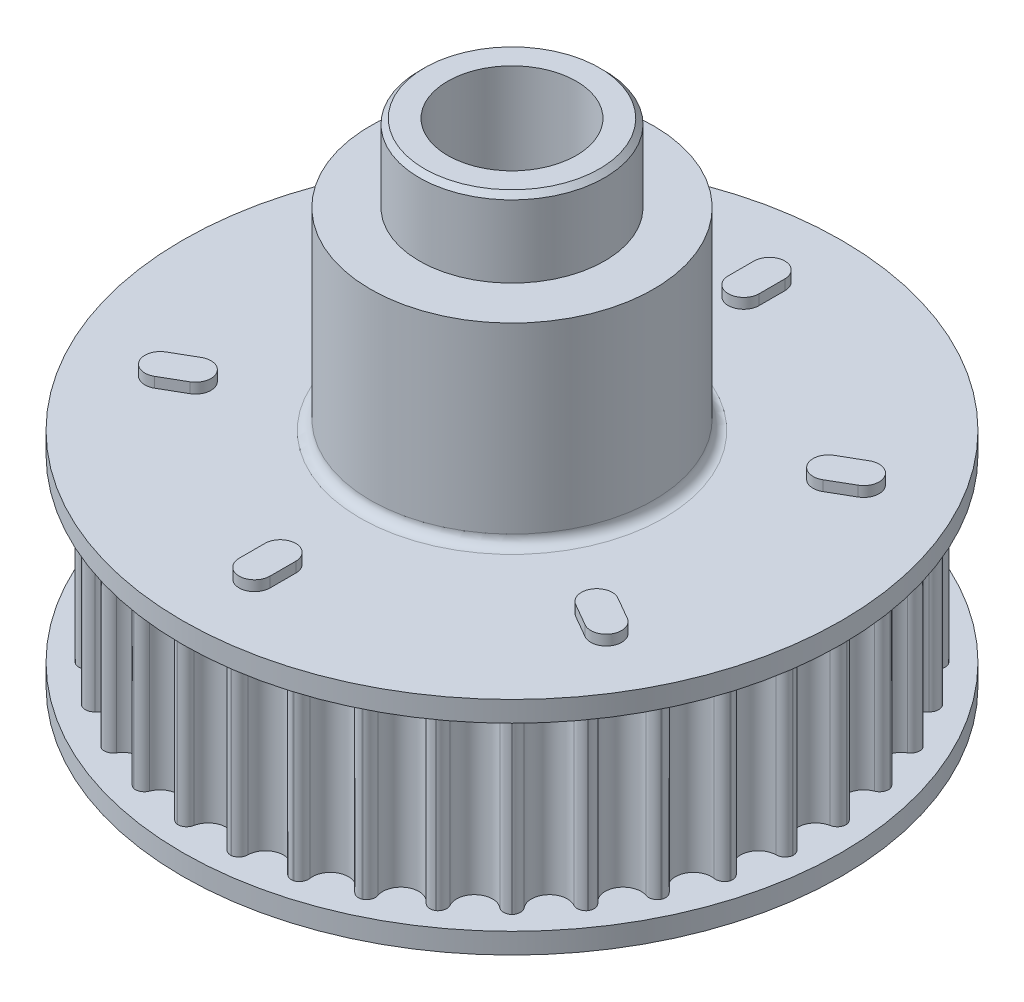
from build123d import *

# Parameters (mm, degrees)
SKETCH1_R           = 12
SKETCH1_R_2         = 2.5
BOSS_EXTRUDE1_DEPTH = 7
CUT_EXTRUDE1_DEPTH  = 19.357559751
CIRPATTERN1_COUNT   = 36
SKETCH4_R           = 12.8
SKETCH4_R_2         = 3.15
BOSS_EXTRUDE4_DEPTH = 0.8
SKETCH5_R           = 12.8
SKETCH5_R_2         = 2.5
BOSS_EXTRUDE5_DEPTH = 0.8
SKETCH6_R           = 5.5
SKETCH6_R_2         = 2.5
BOSS_EXTRUDE6_DEPTH = 7.5
FILLET4_R           = 0.4
SKETCH14_R          = 4.1
CUT_EXTRUDE5_DEPTH  = 3
SKETCH16_R          = 3.6
SKETCH16_R_2        = 2.5
BOSS_EXTRUDE7_DEPTH = 3
SKETCH17_R          = 3.6
CUT_EXTRUDE6_DEPTH  = 1
CHAMFER1_SIZE       = 0.2
BOSS_EXTRUDE8_DEPTH = 0.4
CHAMFER2_SIZE       = 1


with BuildPart() as part:
    # Sketch1 → Boss-Extrude1 (new body)
    with BuildSketch(Plane(origin=(0, 0, 0), x_dir=(1, 0, 0), z_dir=(0, 1, 0))):
        with Locations(Location((0, 0, 0), (0, 0, 270))):
            Circle(SKETCH1_R)
        with Locations(Location((0, 0, 0), (0, 0, 270))):
            Circle(SKETCH1_R_2, mode=Mode.SUBTRACT)
    extrude(amount=BOSS_EXTRUDE1_DEPTH)

    # Sketch2 → Cut-Extrude1 (cut, through all)
    with BuildSketch(Plane(origin=(0, 7, 0), x_dir=(1, 0, 0), z_dir=(0, 1, 0))):
        with BuildLine():
            Line((-1.031733977, 11.955), (-1.2, 11.955))
            Line((-1.2, 11.955), (-1.2, 12.151537955))
            Line((-1.2, 12.151537955), (1.2, 12.151537955))
            Line((1.2, 12.151537955), (1.2, 11.955))
            Line((1.2, 11.955), (1.031733977, 11.955))
            ThreePointArc((1.031733977, 11.955), (0.808406863, 11.87449026), (0.687822652, 11.67))
            ThreePointArc((0.687822652, 11.67), (0, 11.1), (-0.687822652, 11.67))
            ThreePointArc((-0.687822652, 11.67), (-0.808406863, 11.87449026), (-1.031733977, 11.955))
        make_face()
    cut_extrude1 = extrude(amount=-CUT_EXTRUDE1_DEPTH, mode=Mode.SUBTRACT)

    # CirPattern1: Cut-Extrude1 ×36 about axis
    cirpattern1_axis = Axis((0, 0, 0), (0, 1, 0))
    for i in range(1, CIRPATTERN1_COUNT):
        add(cut_extrude1.rotate(cirpattern1_axis, i * 360 / CIRPATTERN1_COUNT), mode=Mode.SUBTRACT)

    # Sketch4 → Boss-Extrude4 (add)
    with BuildSketch(Plane.XZ):
        with Locations(Location((0, 0, 0), (0, 0, 270))):
            Circle(SKETCH4_R)
        with Locations(Location((0, 0, 0), (0, 0, 270))):
            Circle(SKETCH4_R_2, mode=Mode.SUBTRACT)
    extrude(amount=BOSS_EXTRUDE4_DEPTH)

    # Sketch5 → Boss-Extrude5 (add)
    with BuildSketch(Plane(origin=(0, 7, 0), x_dir=(1, 0, 0), z_dir=(0, 1, 0))):
        with Locations(Location((0, 0, 0), (0, 0, 90))):
            Circle(SKETCH5_R)
        with Locations(Location((0, 0, 0), (0, 0, 270))):
            Circle(SKETCH5_R_2, mode=Mode.SUBTRACT)
    extrude(amount=BOSS_EXTRUDE5_DEPTH)

    # Sketch6 → Boss-Extrude6 (add)
    with BuildSketch(Plane(origin=(0, 7.8, 0), x_dir=(1, 0, 0), z_dir=(0, 1, 0))):
        with Locations(Location((0, 0, 0), (0, 0, 270))):
            Circle(SKETCH6_R)
        with Locations(Location((0, 0, 0), (0, 0, 270))):
            Circle(SKETCH6_R_2, mode=Mode.SUBTRACT)
    extrude(amount=BOSS_EXTRUDE6_DEPTH)

    # Fillet4
    fillet4_edges = [part.edges().sort_by_distance(p)[0] for p in [
        (0, 7.8, -5.5),
    ]]
    fillet(fillet4_edges, radius=FILLET4_R)

    # Sketch14 → Cut-Extrude5 (cut)
    with BuildSketch(Plane.XZ.offset(0.8)):
        with Locations(Location((0, 0, 0), (0, 0, 270))):
            Circle(SKETCH14_R)
    extrude(amount=-CUT_EXTRUDE5_DEPTH, mode=Mode.SUBTRACT)

    # Sketch16 → Boss-Extrude7 (add)
    with BuildSketch(Plane(origin=(0, 15.3, 0), x_dir=(1, 0, 0), z_dir=(0, 1, 0))):
        with Locations(Location((0, 0, 0), (0, 0, 270))):
            Circle(SKETCH16_R)
        with Locations(Location((0, 0, 0), (0, 0, 90))):
            Circle(SKETCH16_R_2, mode=Mode.SUBTRACT)
    extrude(amount=BOSS_EXTRUDE7_DEPTH)

    # Sketch17 → Cut-Extrude6 (cut)
    with BuildSketch(Plane.XZ.offset(-2.2)):
        with Locations(Location((0, 0, 0), (0, 0, 90))):
            Circle(SKETCH17_R)
    extrude(amount=-CUT_EXTRUDE6_DEPTH, mode=Mode.SUBTRACT)

    # Chamfer1
    chamfer1_edges = [part.edges().sort_by_distance(p)[0] for p in [
        (0, 18.3, -3.6),
    ]]
    chamfer(chamfer1_edges, length=CHAMFER1_SIZE)

    # Sketch18 → Boss-Extrude8 (add)
    with BuildSketch(Plane(origin=(0, 7.8, 0), x_dir=(1, 0, 0), z_dir=(0, 1, 0))):
        with BuildLine():
            Line((-0.6, 9), (-0.6, 10))
            ThreePointArc((-0.6, 10), (0, 10.6), (0.6, 10))
            Line((0.6, 10), (0.6, 9))
            ThreePointArc((0.6, 9), (0, 8.4), (-0.6, 9))
        make_face()
        with BuildLine():
            Line((7.494228634, 5.019615242), (8.360254038, 5.519615242))
            ThreePointArc((8.360254038, 5.519615242), (9.17986928, 5.3), (8.960254038, 4.480384758))
            Line((8.960254038, 4.480384758), (8.094228634, 3.980384758))
            ThreePointArc((8.094228634, 3.980384758), (7.274613392, 4.2), (7.494228634, 5.019615242))
        make_face()
        with BuildLine():
            Line((8.094228634, -3.980384758), (8.960254038, -4.480384758))
            ThreePointArc((8.960254038, -4.480384758), (9.17986928, -5.3), (8.360254038, -5.519615242))
            Line((8.360254038, -5.519615242), (7.494228634, -5.019615242))
            ThreePointArc((7.494228634, -5.019615242), (7.274613392, -4.2), (8.094228634, -3.980384758))
        make_face()
        with BuildLine():
            Line((0.6, -9), (0.6, -10))
            ThreePointArc((0.6, -10), (0, -10.6), (-0.6, -10))
            Line((-0.6, -10), (-0.6, -9))
            ThreePointArc((-0.6, -9), (0, -8.4), (0.6, -9))
        make_face()
        with BuildLine():
            Line((-7.494228634, -5.019615242), (-8.360254038, -5.519615242))
            ThreePointArc((-8.360254038, -5.519615242), (-9.17986928, -5.3), (-8.960254038, -4.480384758))
            Line((-8.960254038, -4.480384758), (-8.094228634, -3.980384758))
            ThreePointArc((-8.094228634, -3.980384758), (-7.274613392, -4.2), (-7.494228634, -5.019615242))
        make_face()
        with BuildLine():
            Line((-8.094228634, 3.980384758), (-8.960254038, 4.480384758))
            ThreePointArc((-8.960254038, 4.480384758), (-9.17986928, 5.3), (-8.360254038, 5.519615242))
            Line((-8.360254038, 5.519615242), (-7.494228634, 5.019615242))
            ThreePointArc((-7.494228634, 5.019615242), (-7.274613392, 4.2), (-8.094228634, 3.980384758))
        make_face()
    extrude(amount=BOSS_EXTRUDE8_DEPTH)

    # Chamfer2
    chamfer2_edges = [part.edges().sort_by_distance(p)[0] for p in [
        (0, 3.2, -3.6),
    ]]
    chamfer(chamfer2_edges, length=CHAMFER2_SIZE - 0.0001)  # a hair under: the kernel refuses the full size


solid = part.part
